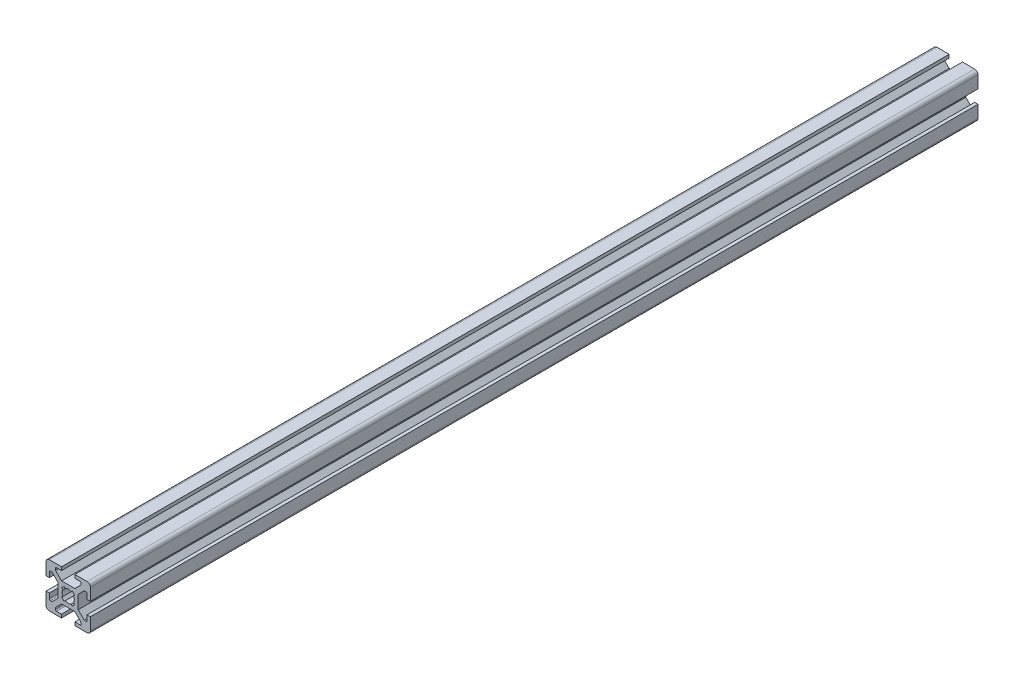
from build123d import *

# Parameters (mm, degrees)
SALIENTE_EXTRUIR1_DEPTH = 400
REDONDEO1_R             = 1.5
REDONDEO2_R             = 0.5
CORTAR_EXTRUIR1_DEPTH   = 401.249921924


with BuildPart() as part:
    # Croquis1 → Saliente-Extruir1 (new body)
    with BuildSketch(Plane.XY):
        Polygon((3, -4.5), (5.7413765, -7.2413765), (5.7413765, -8.5), (3, -8.5), (3, -10), (10, -10), (10, -3), (8.5, -3), (8.5, -5.7413765), (7.2413765, -5.7413765), (4.5, -3), (4.5, 3), (7.2413765, 5.7413765), (8.5, 5.7413765), (8.5, 3), (10, 3), (10, 10), (3, 10), (3, 8.5), (5.7413765, 8.5), (5.7413765, 7.2413765), (3, 4.5), (-3, 4.5), (-5.7413765, 7.2413765), (-5.7413765, 8.5), (-3, 8.5), (-3, 10), (-10, 10), (-10, 3), (-8.5, 3), (-8.5, 5.7413765), (-7.2413765, 5.7413765), (-4.5, 3), (-4.5, -3), (-7.2413765, -5.7413765), (-8.5, -5.7413765), (-8.5, -3), (-10, -3), (-10, -10), (-3, -10), (-3, -8.5), (-5.7413765, -8.5), (-5.7413765, -7.2413765), (-3, -4.5), align=None)
    extrude(amount=SALIENTE_EXTRUIR1_DEPTH)

    # Redondeo1
    redondeo1_edges = [part.edges().sort_by_distance(p)[0] for p in [
        (10, -10, 200),
        (-10, -10, 200),
        (10, 10, 200),
        (-10, 10, 200),
    ]]
    fillet(redondeo1_edges, radius=REDONDEO1_R)

    # Redondeo2
    redondeo2_edges = [part.edges().sort_by_distance(p)[0] for p in [
        (-5.7413765, -8.5, 200),
        (5.7413765, 8.5, 200),
        (-5.7413765, 8.5, 200),
        (8.5, -5.7413765, 200),
        (-8.5, -5.7413765, 200),
        (8.5, 5.7413765, 200),
        (-8.5, 5.7413765, 200),
    ]]
    fillet(redondeo2_edges, radius=REDONDEO2_R)

    # Croquis2 → Cortar-Extruir1 (cut, through all)
    with BuildSketch(Plane(origin=(0, 0, 0), x_dir=(-1, 0, 0), z_dir=(0, 0, -1))):
        with BuildLine():
            Line((-1.340498607, 2.401158779), (-1.870828693, 2.931488865))
            Line((-1.870828693, 2.931488865), (-2.931488865, 1.870828693))
            Line((-2.931488865, 1.870828693), (-2.401158779, 1.340498607))
            ThreePointArc((-2.401158779, 1.340498607), (-2.75, 0), (-2.401158779, -1.340498607))
            Line((-2.401158779, -1.340498607), (-2.931488865, -1.870828693))
            Line((-2.931488865, -1.870828693), (-1.870828693, -2.931488865))
            Line((-1.870828693, -2.931488865), (-1.340498607, -2.401158779))
            ThreePointArc((-1.340498607, -2.401158779), (0, -2.75), (1.340498607, -2.401158779))
            Line((1.340498607, -2.401158779), (1.870828693, -2.931488865))
            Line((1.870828693, -2.931488865), (2.931488865, -1.870828693))
            Line((2.931488865, -1.870828693), (2.401158779, -1.340498607))
            ThreePointArc((2.401158779, -1.340498607), (2.75, 0), (2.401158779, 1.340498607))
            Line((2.401158779, 1.340498607), (2.931488865, 1.870828693))
            Line((2.931488865, 1.870828693), (1.870828693, 2.931488865))
            Line((1.870828693, 2.931488865), (1.340498607, 2.401158779))
            ThreePointArc((1.340498607, 2.401158779), (0, 2.75), (-1.340498607, 2.401158779))
        make_face()
    extrude(amount=-CORTAR_EXTRUIR1_DEPTH, mode=Mode.SUBTRACT)


solid = part.part
